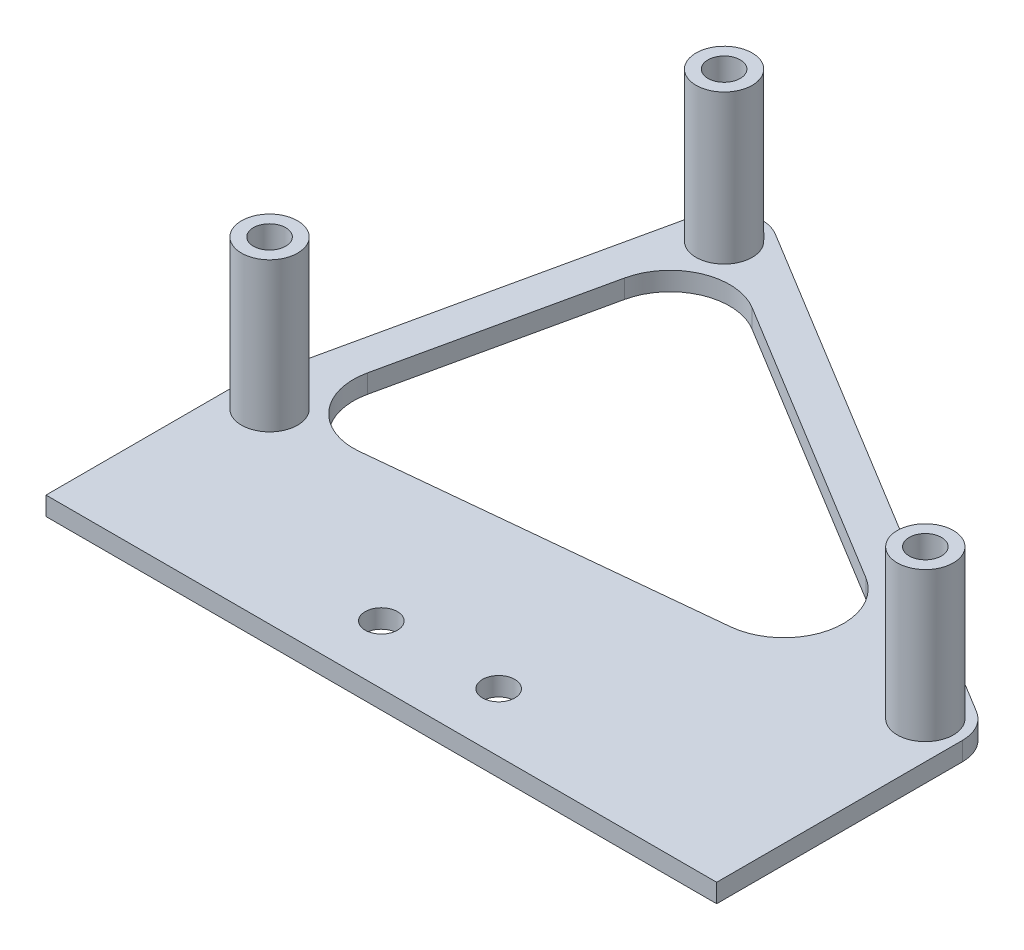
from build123d import *

# Parameters (mm, degrees)
BOSS_EXTRUDE1_DEPTH = 3.175
SHELL1_START        = -3.175
SHELL1_DEPTH        = 3.175
FILLET1_R           = 10.16
BOSS_EXTRUDE2_DEPTH = 3.175
SKETCH1_R           = 2.75
CUT_EXTRUDE1_DEPTH  = 81.407776093
EXTRUDE_THIN1_START = 25.4
SKETCH5_R           = 4.782
SKETCH5_R_2         = 2.75
EXTRUDE_THIN1_DEPTH = 25.4
SKETCH6_R           = 2.749999961
CUT_EXTRUDE2_DEPTH  = 85.264404295


# Read off the part's stored shape, not the designer's step: Shell1
with BuildPart() as part:
    # Sketch2 → Boss-Extrude1 (new body)
    with BuildSketch(Plane(origin=(0, 0, 0), x_dir=(1, 0, 0), z_dir=(0, 1, 0))):
        with BuildLine():
            Line((-60.494192364, -19.59062768), (-46.524192364, 43.90937232))
            ThreePointArc((-46.524192364, 43.90937232), (-42.81709678, 48.384476595), (-37.020836887, 47.969160828))
            Line((-37.020836887, 47.969160828), (50.609163113, -5.370839172))
            ThreePointArc((50.609163113, -5.370839172), (53.499476113, -12.202811), (47.939348616, -17.113486158))
            Line((47.939348616, -17.113486158), (-53.660651384, -27.273486158))
            ThreePointArc((-53.660651384, -27.273486158), (-59.037220059, -25.175205156), (-60.494192364, -19.59062768))
        make_face()
    extrude(amount=-BOSS_EXTRUDE1_DEPTH)

    # Shell1 outline → Shell1 (cut)
    with BuildSketch(Plane(origin=(0, 0, 0), x_dir=(1, 0, 0), z_dir=(0, 1, 0)).offset(SHELL1_START)):
        Polygon((-54.2925, -20.955), (47.3075, -10.795), (-40.3225, 42.545), align=None)
    extrude(amount=SHELL1_DEPTH, mode=Mode.SUBTRACT)

    # Fillet1
    fillet1_edges = [part.edges().sort_by_distance(p)[0] for p in [
        (-40.3225, -1.5875, -42.545),
        (47.3075, -1.5875, 10.795),
        (-54.2925, -1.5875, 20.955),
    ]]
    fillet(fillet1_edges, radius=FILLET1_R)

    # Sketch3 → Boss-Extrude2 (add)
    with BuildSketch(Plane(origin=(0, 0, 0), x_dir=(1, 0, 0), z_dir=(0, 1, 0))):
        with BuildLine():
            Line((-60.6425, -20.955), (-60.6425, -52.705))
            Line((-60.6425, -52.705), (53.6575, -52.705))
            Line((53.6575, -52.705), (53.6575, -10.795))
            ThreePointArc((53.6575, -10.795), (52.015723588, -15.055883787), (47.939348616, -17.113486158))
            Line((47.939348616, -17.113486158), (-53.660651384, -27.273486158))
            ThreePointArc((-53.660651384, -27.273486158), (-58.553383787, -25.663223588), (-60.6425, -20.955))
        make_face()
    extrude(amount=-BOSS_EXTRUDE2_DEPTH)

    # Sketch1 → Cut-Extrude1 (cut, through all)
    with BuildSketch(Plane(origin=(0, 0, 0), x_dir=(1, 0, 0), z_dir=(0, 1, 0))):
        with Locations(Location((-54.2925, -20.955, 0), (0, 0, 270))):
            Circle(SKETCH1_R)
        with Locations(Location((47.3075, -10.795, 0), (0, 0, 270))):
            Circle(SKETCH1_R)
        with Locations(Location((-40.3225, 42.545, 0), (0, 0, 270))):
            Circle(SKETCH1_R)
    extrude(amount=-CUT_EXTRUDE1_DEPTH, mode=Mode.SUBTRACT)

    # Sketch5 → Extrude-Thin1 (add)
    # profile 1 of 3: a face of its own
    with BuildSketch(Plane(origin=(0, 0, 0), x_dir=(1, 0, 0), z_dir=(0, 1, 0)).offset(EXTRUDE_THIN1_START)):
        with Locations((47.3075, -10.795)):
            Circle(SKETCH5_R)
        with Locations((47.3075, -10.795)):
            Circle(SKETCH5_R_2, mode=Mode.SUBTRACT)
    # profile 2 of 3: a face of its own
    with BuildSketch(Plane(origin=(0, 0, 0), x_dir=(1, 0, 0), z_dir=(0, 1, 0)).offset(EXTRUDE_THIN1_START)):
        with Locations((-54.2925, -20.955)):
            Circle(SKETCH5_R)
        with Locations((-54.2925, -20.955)):
            Circle(SKETCH5_R_2, mode=Mode.SUBTRACT)
    # profile 3 of 3: a face of its own
    with BuildSketch(Plane(origin=(0, 0, 0), x_dir=(1, 0, 0), z_dir=(0, 1, 0)).offset(EXTRUDE_THIN1_START)):
        with Locations((-40.3225, 42.545)):
            Circle(SKETCH5_R)
        with Locations((-40.3225, 42.545)):
            Circle(SKETCH5_R_2, mode=Mode.SUBTRACT)
    extrude(amount=-EXTRUDE_THIN1_DEPTH)

    # Sketch6 → Cut-Extrude2 (cut, through all)
    with BuildSketch(Plane(origin=(0, 0, 0), x_dir=(1, 0, 0), z_dir=(0, 1, 0))):
        with Locations(Location((-13.492499939, -42.705, 0), (0, 0, 270))):
            Circle(SKETCH6_R)
        with Locations(Location((6.507499939, -42.705, 0), (0, 0, 270))):
            Circle(SKETCH6_R)
    extrude(amount=-CUT_EXTRUDE2_DEPTH, mode=Mode.SUBTRACT)


solid = part.part
